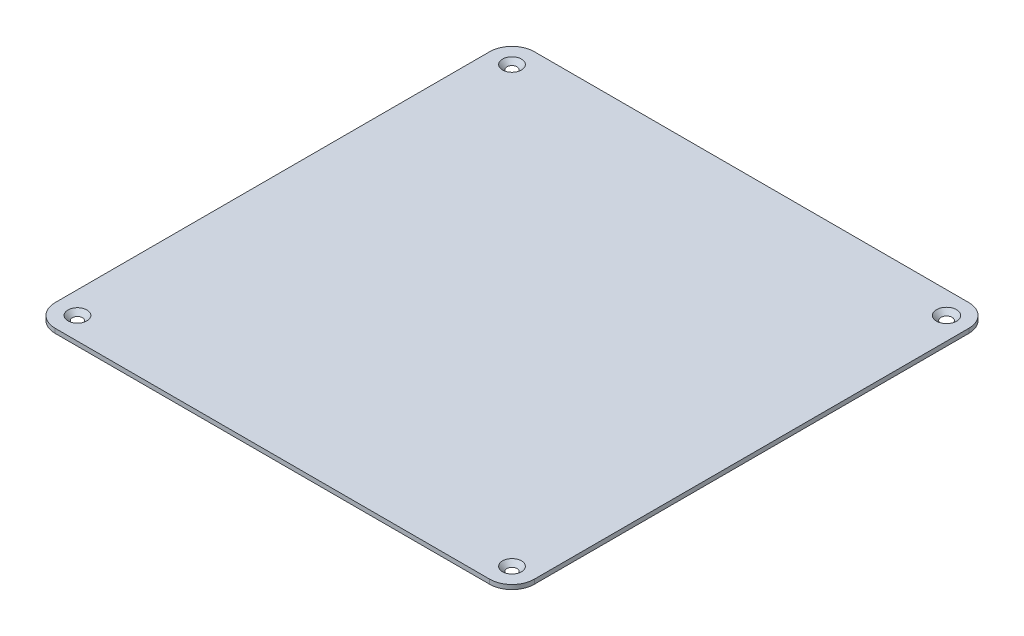
from build123d import *

# Parameters (mm, degrees)
SKETCH1_W           = 215
SKETCH1_H           = 215
BOSS_EXTRUDE1_DEPTH = 2
SKETCH2_R           = 2.25
SKETCH2_R_2         = 2.5
CUT_EXTRUDE1_DEPTH  = 153.041112861
CHAMFER1_SIZE       = 2
FILLET1_R           = 10


with BuildPart() as part:
    # Sketch1 → Boss-Extrude1 (new body)
    with BuildSketch(Plane(origin=(0, 0, 0), x_dir=(1, 0, 0), z_dir=(0, 1, 0))):
        Rectangle(SKETCH1_W, SKETCH1_H)
    extrude(amount=BOSS_EXTRUDE1_DEPTH)

    # Sketch2 → Cut-Extrude1 (cut, through all)
    with BuildSketch(Plane(origin=(0, 2, 0), x_dir=(1, 0, 0), z_dir=(0, 1, 0))):
        with Locations(Location((-97.5, 97.5, 0), (0, 0, 270))):
            Circle(SKETCH2_R)
        with Locations(Location((-97.5, -97.5, 0), (0, 0, 270))):
            Circle(SKETCH2_R)
        with Locations(Location((97.5, -97.5, 0), (0, 0, 270))):
            Circle(SKETCH2_R)
        with Locations(Location((97.5, 97.5, 0), (0, 0, 270))):
            Circle(SKETCH2_R_2)
    extrude(amount=-CUT_EXTRUDE1_DEPTH, mode=Mode.SUBTRACT)

    # Chamfer1
    chamfer1_edges = [part.edges().sort_by_distance(p)[0] for p in [
        (-97.5, 2, -99.75),
        (-97.5, 2, 95.25),
        (97.5, 2, 95.25),
        (97.5, 2, -100),
    ]]
    chamfer(chamfer1_edges, length=CHAMFER1_SIZE - 0.0001)  # a hair under: the kernel refuses the full size

    # Fillet1
    fillet1_edges = [part.edges().sort_by_distance(p)[0] for p in [
        (-107.5, 1, -107.5),
        (107.5, 1, -107.5),
        (107.5, 1, 107.5),
        (-107.5, 1, 107.5),
    ]]
    fillet(fillet1_edges, radius=FILLET1_R)


solid = part.part
